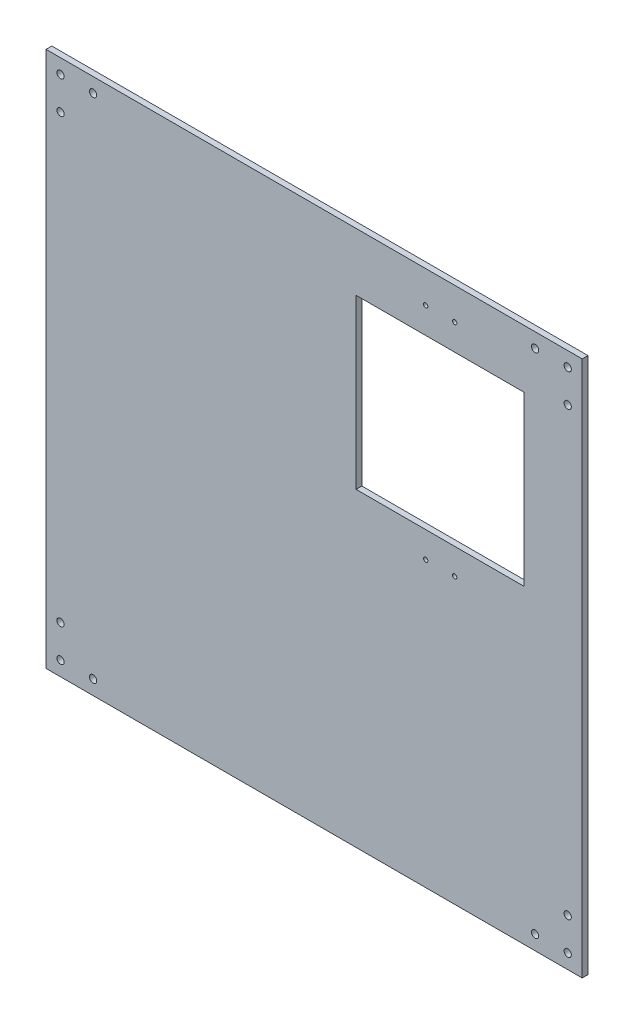
from build123d import *

# Parameters (mm, degrees)
SKETCH_1_W          = 370
SKETCH_1_H          = 370
EXTRUDE_1_DEPTH     = 4
SKETCH_2_R          = 2.5
CUT_EXTRUDE_1_DEPTH = 262.660084843
SKETCH_3_W          = 116
SKETCH_3_H          = 116
CUT_EXTRUDE_2_DEPTH = 10
SKETCH_4_R          = 1.5
CUT_EXTRUDE_3_DEPTH = 10


with BuildPart() as part:
    # 草图1 → 凸台-拉伸1 (new body)
    with BuildSketch(Plane.XY):
        Rectangle(SKETCH_1_W, SKETCH_1_H)
    extrude(amount=EXTRUDE_1_DEPTH)

    # 草图2 → 切除-拉伸1 (cut, through all)
    with BuildSketch(Plane.XY.offset(4)):
        with Locations((-175, -175)):
            Circle(SKETCH_2_R)
        with Locations((-152.5, -175)):
            Circle(SKETCH_2_R)
        with Locations((-175, -152.5)):
            Circle(SKETCH_2_R)
        with Locations((-152.5, 175)):
            Circle(SKETCH_2_R)
        with Locations((-175, 152.5)):
            Circle(SKETCH_2_R)
        with Locations((-175, 175)):
            Circle(SKETCH_2_R)
        with Locations((175, 152.5)):
            Circle(SKETCH_2_R)
        with Locations((152.5, 175)):
            Circle(SKETCH_2_R)
        with Locations((175, 175)):
            Circle(SKETCH_2_R)
        with Locations((152.5, -175)):
            Circle(SKETCH_2_R)
        with Locations((175, -152.5)):
            Circle(SKETCH_2_R)
        with Locations((175, -175)):
            Circle(SKETCH_2_R)
    extrude(amount=-CUT_EXTRUDE_1_DEPTH, mode=Mode.SUBTRACT)

    # 草图3 → 切除-拉伸2 (cut)
    with BuildSketch(Plane(origin=(0, 0, 0), x_dir=(-1, 0, 0), z_dir=(0, 0, -1))):
        with Locations((-87, 87)):
            Rectangle(SKETCH_3_W, SKETCH_3_H)
    extrude(amount=-CUT_EXTRUDE_2_DEPTH, mode=Mode.SUBTRACT)

    # 草图4 → 切除-拉伸3 (cut)
    with BuildSketch(Plane(origin=(0, 0, 0), x_dir=(-1, 0, 0), z_dir=(0, 0, -1))):
        with Locations((-97, 11)):
            Circle(SKETCH_4_R)
        with Locations((-77, 11)):
            Circle(SKETCH_4_R)
        with Locations((-97, 163)):
            Circle(SKETCH_4_R)
        with Locations((-77, 163)):
            Circle(SKETCH_4_R)
    extrude(amount=-CUT_EXTRUDE_3_DEPTH, mode=Mode.SUBTRACT)


solid = part.part
